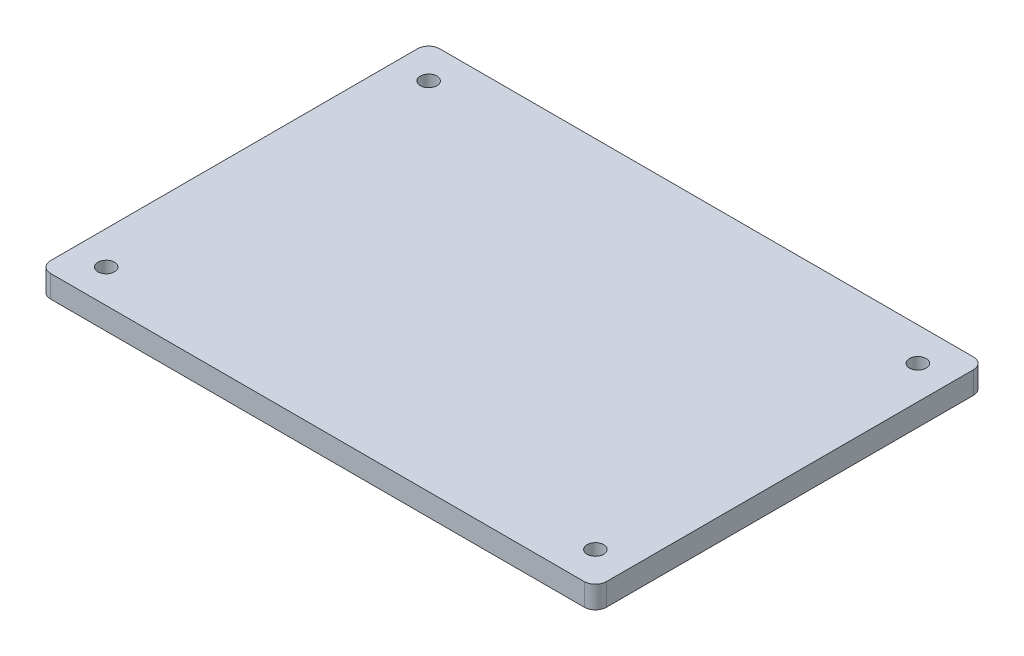
from build123d import *

# Parameters (mm, degrees)
CROQUIS1_W                = 200
CROQUIS1_H                = 140
SALIENTE_EXTRUIR1_DEPTH   = 8
REDONDEO1_R               = 4
CROQUIS2_R                = 3
CORTAR_EXTRUIR1_DEPTH     = 123.327429467
SIMETR_A2_COPY_1_SKETCH_R = 3
SIMETR_A2_COPY_1_DEPTH    = 123.327429467
SIMETR_A2_COPY_2_SKETCH_R = 3
SIMETR_A2_COPY_2_DEPTH    = 123.327429467


with BuildPart() as part:
    # Croquis1 → Saliente-Extruir1 (new body)
    with BuildSketch(Plane(origin=(0, 0, 0), x_dir=(1, 0, 0), z_dir=(0, 1, 0))):
        Rectangle(CROQUIS1_W, CROQUIS1_H)
    extrude(amount=SALIENTE_EXTRUIR1_DEPTH)

    # Redondeo1
    redondeo1_edges = [part.edges().sort_by_distance(p)[0] for p in [
        (-100, 4, -70),
        (100, 4, -70),
        (100, 4, 70),
        (-100, 4, 70),
    ]]
    fillet(redondeo1_edges, radius=REDONDEO1_R)

    # Croquis2 → Cortar-Extruir1 (cut, through all)
    with BuildSketch(Plane(origin=(0, 8, 0), x_dir=(1, 0, 0), z_dir=(0, 1, 0))):
        with Locations((88, 58)):
            Circle(CROQUIS2_R)
    cortar_extruir1 = extrude(amount=-CORTAR_EXTRUIR1_DEPTH, mode=Mode.SUBTRACT)

    # Simetría1: Cortar-Extruir1 across plane
    add(cortar_extruir1.mirror(Plane.XY), mode=Mode.SUBTRACT)

    # Simetría2 copy 1 sketch → Simetría2 copy 1 (cut, through all)
    with BuildSketch(Plane(origin=(0, 8, 0), x_dir=(-1, 0, 0), z_dir=(0, 1, 0))):
        with Locations((88, 58)):
            Circle(SIMETR_A2_COPY_1_SKETCH_R)
    extrude(amount=-SIMETR_A2_COPY_1_DEPTH, mode=Mode.SUBTRACT)

    # Simetría2 copy 2 sketch → Simetría2 copy 2 (cut, through all)
    with BuildSketch(Plane(origin=(0, 8, 0), x_dir=(-1, 0, 0), z_dir=(0, 1, 0))):
        with Locations((88, -58)):
            Circle(SIMETR_A2_COPY_2_SKETCH_R)
    extrude(amount=-SIMETR_A2_COPY_2_DEPTH, mode=Mode.SUBTRACT)


solid = part.part
